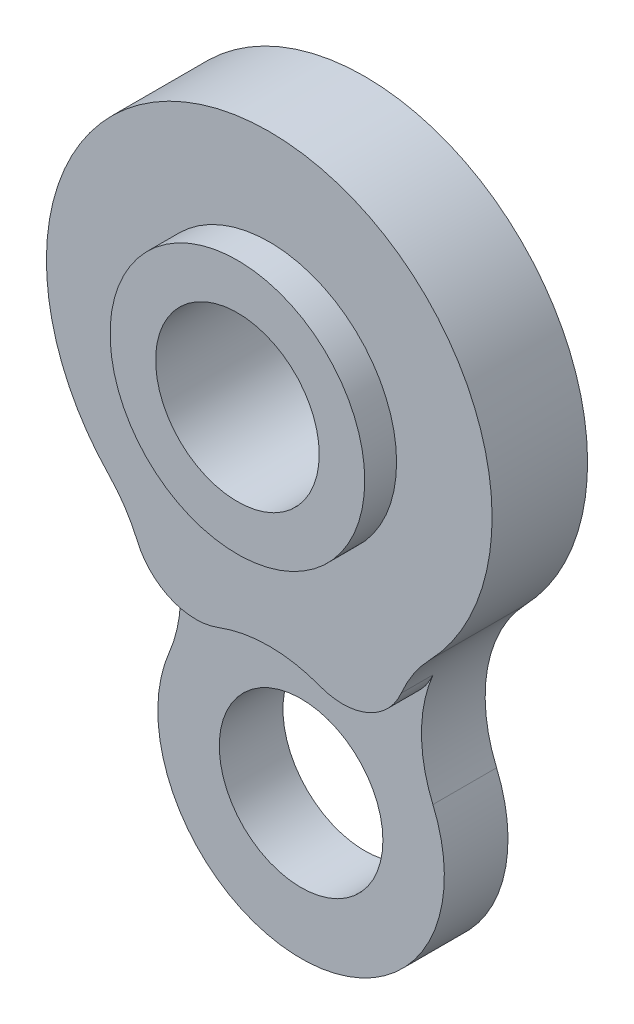
from build123d import *

# Parameters (mm, degrees)
SKETCH2_R           = 3.175
SKETCH2_R_2         = 2.0399375
BOSS_EXTRUDE1_DEPTH = 2.38125
SKETCH2_6_R         = 3.175
SKETCH2_6_R_2       = 2.0399375
BOSS_EXTRUDE2_DEPTH = 3.175
CUT_EXTRUDE1_START  = -0.79375
SKETCH3_R           = 3.571875
SKETCH3_R_2         = 2.0399375
CUT_EXTRUDE1_DEPTH  = 0.79375
FILLET1_START       = 1.5875
FILLET1_DEPTH       = 0.79375


with BuildPart() as part:
    # Sketch2 → Boss-Extrude1 (new body)
    with BuildSketch(Plane.XY):
        with BuildLine():
            ThreePointArc((-4.001636369, -3.854714053), (-3.061446657, -5.68510333), (-3.28705844, -7.730434825))
            ThreePointArc((-3.28705844, -7.730434825), (3.2e-08, -12.7), (3.287058415, -7.730434766))
            ThreePointArc((3.287058415, -7.730434766), (3.061446657, -5.685103331), (4.001636324, -3.8547141))
            ThreePointArc((4.001636324, -3.8547141), (3.3e-08, 5.55625), (-4.001636369, -3.854714053))
        make_face()
        Circle(SKETCH2_R, mode=Mode.SUBTRACT)
        with Locations((0, -9.128125)):
            Circle(SKETCH2_R_2, mode=Mode.SUBTRACT)
    extrude(amount=BOSS_EXTRUDE1_DEPTH)

    # Sketch2<6> → Boss-Extrude2 (add)
    with BuildSketch(Plane.XY):
        Circle(SKETCH2_6_R)
        Circle(SKETCH2_6_R_2, mode=Mode.SUBTRACT)
    extrude(amount=BOSS_EXTRUDE2_DEPTH)

    # Sketch3 → Cut-Extrude1 (cut)
    with BuildSketch(Plane.XY.offset(2.38125).offset(CUT_EXTRUDE1_START)):
        with Locations((0, -9.128125)):
            Circle(SKETCH3_R)
        with Locations((0, -9.128125)):
            Circle(SKETCH3_R_2, mode=Mode.SUBTRACT)
    extrude(amount=CUT_EXTRUDE1_DEPTH, mode=Mode.SUBTRACT)

    # Fillet1: read off the stored shape, not the designer's step
    # Fillet1 outline → Fillet1 (cut)
    with BuildSketch(Plane.XY.offset(FILLET1_START)):
        with BuildLine():
            ThreePointArc((-3.287058422, -7.730434783), (-2.475434769, -6.553146608), (-1.267079181, -5.788543984))
            ThreePointArc((-1.267079181, -5.788543984), (-2.451421136, -5.765200609), (-3.289884364, -4.928426927))
            ThreePointArc((-3.289884364, -4.928426927), (-3.002243662, -6.329142182), (-3.287058422, -7.730434783))
        make_face()
        with BuildLine():
            ThreePointArc((3.289884364, -4.928426927), (2.451421136, -5.765200609), (1.267079181, -5.788543984))
            ThreePointArc((1.267079181, -5.788543984), (2.475434769, -6.553146608), (3.287058422, -7.730434783))
            ThreePointArc((3.287058422, -7.730434783), (3.002243662, -6.329142182), (3.289884364, -4.928426927))
        make_face()
    extrude(amount=FILLET1_DEPTH, mode=Mode.SUBTRACT)


solid = part.part
